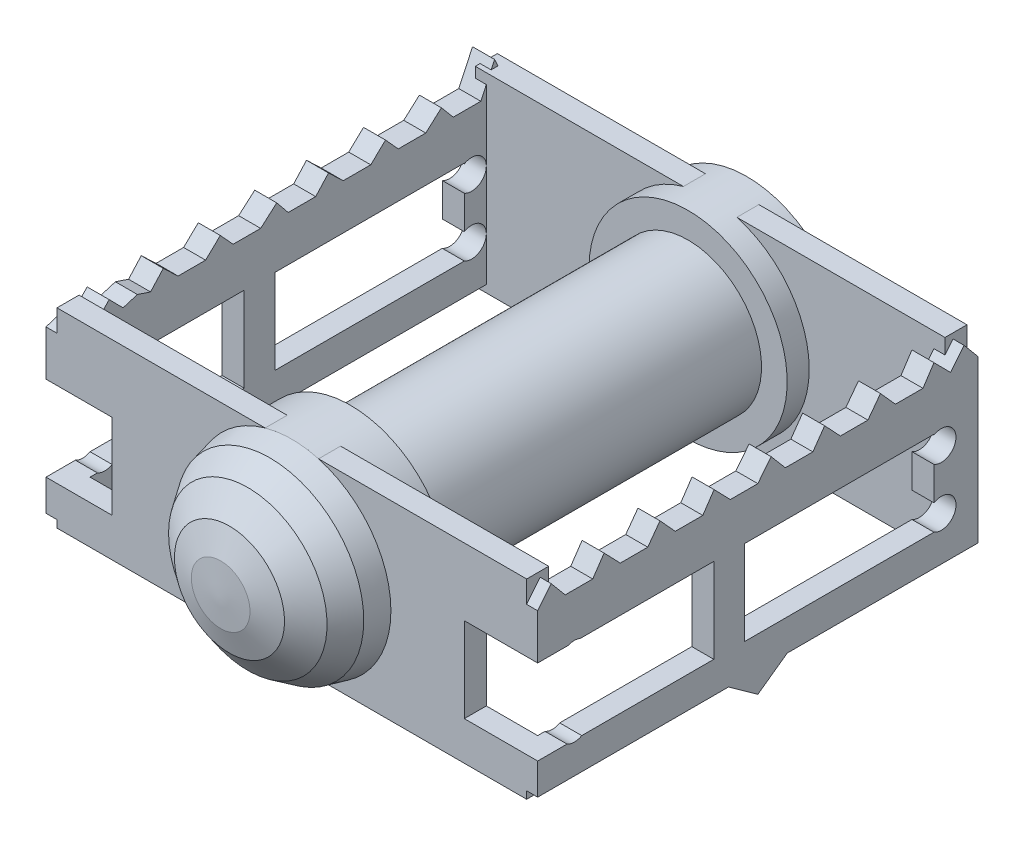
from build123d import *

# Parameters (mm, degrees)
PLACA_DELANTERA_START               = 203
PLACA_DELANTERA_DEPTH               = 3
AGUJERO_PLACA_DELANTERA_1_PROFILE_R = 2
AGUJERO_PLACA_DELANTERA_2_PROFILE_R = 2
AGUJERO_PLACA_DELANTERA_3_PROFILE_R = 2
AGUJERO_PLACA_DELANTERA_4_PROFILE_R = 2
PLACA_TRASERA_START                 = 139
PLACA_TRASERA_DEPTH                 = 3
AGUJERO_PLACA_TRASERA_1_PROFILE_R   = 2
AGUJERO_PLACA_TRASERA_2_PROFILE_R   = 2
AGUJERO_PLACA_TRASERA_3_PROFILE_R   = 2
AGUJERO_PLACA_TRASERA_4_PROFILE_R   = 2
MARCO_INTERIOR_START                = 86
SK_MARCO_INTERIOR_W                 = 64
SK_MARCO_INTERIOR_H                 = 26
SK_MARCO_INTERIOR_R                 = 11
MARCO_INTERIOR_DEPTH                = 3
MARCO_EXTERIOR_START                = 143
SK_MARCO_EXTERIOR_W                 = 64
SK_MARCO_EXTERIOR_H                 = 26
SK_MARCO_EXTERIOR_R                 = 11
MARCO_EXTERIOR_DEPTH                = 3
CROQUIS17_W                         = 25.795648089
CROQUIS17_H                         = 11.561302328
CORTAR_EXTRUIR1_DEPTH               = 10
MATRIZL1_COPY_1_SKETCH_W            = 25.795648089
MATRIZL1_COPY_1_SKETCH_H            = 11.561302328
MATRIZL1_COPY_1_DEPTH               = 10
MATRIZL1_COPY_2_SKETCH_W            = 25.795648089
MATRIZL1_COPY_2_SKETCH_H            = 11.561302328
MATRIZL1_COPY_2_DEPTH               = 10


with BuildPart() as part:
    # Sk_Eje_cuerpo → Eje_cuerpo (revolve)
    with BuildSketch(Plane(origin=(0, 0, 0), x_dir=(1, 0, 0), z_dir=(0, 1, 0))):
        Polygon((183.5, -84), (186, -84), (186, -92), (182.5, -92), (182.5, -138), (186, -138), (186, -146), (185.3, -149), (183.3, -152), (180, -154.5), (176.5, -155.7), (172.5, -156), (172.5, -147), (183.5, -147), (183.5, -138.5), (178.8, -138.5), (178.8, -91.5), (183.5, -91.5), align=None)
    revolve(axis=Axis((172.5, 0, 62.1), (0, 0, 1)))



with BuildPart() as body_2:
    # Sk_Placa_delantera → Placa_delantera (new body)
    with BuildSketch(Plane(origin=(0, 0, 0), x_dir=(0, 0, -1), z_dir=(1, 0, 0)).offset(PLACA_DELANTERA_START)):
        Polygon((-86, -12), (-112, -12), (-116, -14.871140988), (-120, -12), (-146, -12), (-146, 10), (-144.158210385, 12.281479313), (-142.25, 10), (-140.792887545, 10), (-138.5, 10), (-136.9468043, 12.281479313), (-134.75, 10), (-133.341101257, 10), (-131, 10), (-129.334764543, 12.281479313), (-127.25, 10), (-125.809188235, 10), (-123.5, 10), (-121.96310499, 12.281479313), (-119.75, 10), (-117.956768276, 10), (-116, 10), (-114.190811765, 12.281479313), (-112.25, 10), (-110.665235457, 10), (-108.5, 10), (-106.899278945, 12.281479313), (-104.75, 10), (-103.0531957, 10), (-101, 10), (-99.287239189, 12.281479313), (-97.25, 10), (-95.601409412, 10), (-93.5, 10), (-92, 12.281479313), (-89.75, 10), (-87.909242921, 12.281479313), (-86, 10), align=None)
    extrude(amount=PLACA_DELANTERA_DEPTH)

    # Agujero_Placa_delantera_1: sweep along a curve in space
    with BuildLine() as agujero_placa_delantera_1_path:
        Line((201.5, -6, 91), (207.5, -6, 91))
    # Agujero_Placa_delantera_1 profile (on start of the path) → Agujero_Placa_delantera_1 (sweep, cut)
    with BuildSketch(Plane(origin=(201.5, -6, 91), x_dir=(0, 0, 1), z_dir=(1, 0, 0))):
        Circle(AGUJERO_PLACA_DELANTERA_1_PROFILE_R)
    sweep(path=agujero_placa_delantera_1_path.line, mode=Mode.SUBTRACT)

    # Agujero_Placa_delantera_2: sweep along a curve in space
    with BuildLine() as agujero_placa_delantera_2_path:
        Line((201.5, 2, 91), (207.5, 2, 91))
    # Agujero_Placa_delantera_2 profile (on start of the path) → Agujero_Placa_delantera_2 (sweep, cut)
    with BuildSketch(Plane(origin=(201.5, 2, 91), x_dir=(0, 0, 1), z_dir=(1, 0, 0))):
        Circle(AGUJERO_PLACA_DELANTERA_2_PROFILE_R)
    sweep(path=agujero_placa_delantera_2_path.line, mode=Mode.SUBTRACT)

    # Agujero_Placa_delantera_3: sweep along a curve in space
    with BuildLine() as agujero_placa_delantera_3_path:
        Line((201.5, -6, 141), (207.5, -6, 141))
    # Agujero_Placa_delantera_3 profile (on start of the path) → Agujero_Placa_delantera_3 (sweep, cut)
    with BuildSketch(Plane(origin=(201.5, -6, 141), x_dir=(0, 0, 1), z_dir=(1, 0, 0))):
        Circle(AGUJERO_PLACA_DELANTERA_3_PROFILE_R)
    sweep(path=agujero_placa_delantera_3_path.line, mode=Mode.SUBTRACT)

    # Agujero_Placa_delantera_4: sweep along a curve in space
    with BuildLine() as agujero_placa_delantera_4_path:
        Line((201.5, 2, 141), (207.5, 2, 141))
    # Agujero_Placa_delantera_4 profile (on start of the path) → Agujero_Placa_delantera_4 (sweep, cut)
    with BuildSketch(Plane(origin=(201.5, 2, 141), x_dir=(0, 0, 1), z_dir=(1, 0, 0))):
        Circle(AGUJERO_PLACA_DELANTERA_4_PROFILE_R)
    sweep(path=agujero_placa_delantera_4_path.line, mode=Mode.SUBTRACT)


with BuildPart() as body_3:
    # Sk_Placa_trasera → Placa_trasera (new body)
    with BuildSketch(Plane(origin=(0, 0, 0), x_dir=(0, 0, -1), z_dir=(1, 0, 0)).offset(PLACA_TRASERA_START)):
        Polygon((-86, -12), (-146, -12), (-146, 10), (-144.158210385, 10.594712137), (-142.25, 10), (-140.392253874, 11.91414288), (-138.5, 10), (-136.546170629, 10.594712137), (-134.75, 10), (-133.02059432, 11.91414288), (-131, 10), (-129.014257606, 10), (-127.25, 10), (-125.248301095, 11.91414288), (-123.5, 10), (-121.241964381, 10), (-119.75, 10), (-117.556134605, 11.91414288), (-116, 10), (-113.790178093, 10), (-112.25, 10), (-110.504981988, 11.91414288), (-108.5, 10), (-106.498645274, 10), (-104.75, 10), (-102.732688763, 11.91414288), (-101, 10), (-98.646225315, 10), (-97.25, 10), (-95.120649006, 11.91414288), (-93.5, 10), (-91.274565761, 10), (-89.75, 10), (-87.875, 14), (-86, 10), align=None)
    extrude(amount=PLACA_TRASERA_DEPTH)

    # Agujero_Placa_trasera_1: sweep along a curve in space
    with BuildLine() as agujero_placa_trasera_1_path:
        Line((137.5, -6, 91), (143.5, -6, 91))
    # Agujero_Placa_trasera_1 profile (on start of the path) → Agujero_Placa_trasera_1 (sweep, cut)
    with BuildSketch(Plane(origin=(137.5, -6, 91), x_dir=(0, 0, 1), z_dir=(1, 0, 0))):
        Circle(AGUJERO_PLACA_TRASERA_1_PROFILE_R)
    sweep(path=agujero_placa_trasera_1_path.line, mode=Mode.SUBTRACT)

    # Agujero_Placa_trasera_2: sweep along a curve in space
    with BuildLine() as agujero_placa_trasera_2_path:
        Line((137.5, 2, 91), (143.5, 2, 91))
    # Agujero_Placa_trasera_2 profile (on start of the path) → Agujero_Placa_trasera_2 (sweep, cut)
    with BuildSketch(Plane(origin=(137.5, 2, 91), x_dir=(0, 0, 1), z_dir=(1, 0, 0))):
        Circle(AGUJERO_PLACA_TRASERA_2_PROFILE_R)
    sweep(path=agujero_placa_trasera_2_path.line, mode=Mode.SUBTRACT)

    # Agujero_Placa_trasera_3: sweep along a curve in space
    with BuildLine() as agujero_placa_trasera_3_path:
        Line((137.5, -6, 141), (143.5, -6, 141))
    # Agujero_Placa_trasera_3 profile (on start of the path) → Agujero_Placa_trasera_3 (sweep, cut)
    with BuildSketch(Plane(origin=(137.5, -6, 141), x_dir=(0, 0, 1), z_dir=(1, 0, 0))):
        Circle(AGUJERO_PLACA_TRASERA_3_PROFILE_R)
    sweep(path=agujero_placa_trasera_3_path.line, mode=Mode.SUBTRACT)

    # Agujero_Placa_trasera_4: sweep along a curve in space
    with BuildLine() as agujero_placa_trasera_4_path:
        Line((137.5, 2, 141), (143.5, 2, 141))
    # Agujero_Placa_trasera_4 profile (on start of the path) → Agujero_Placa_trasera_4 (sweep, cut)
    with BuildSketch(Plane(origin=(137.5, 2, 141), x_dir=(0, 0, 1), z_dir=(1, 0, 0))):
        Circle(AGUJERO_PLACA_TRASERA_4_PROFILE_R)
    sweep(path=agujero_placa_trasera_4_path.line, mode=Mode.SUBTRACT)


with BuildPart() as part_1:
    add(part.part)

    add(body_2.part)  # Marco_interior merges body 2

    add(body_3.part)  # Marco_interior merges body 3
    # Sk_Marco_interior → Marco_interior (add)
    with BuildSketch(Plane.XY.offset(MARCO_INTERIOR_START)):
        with Locations((172.5, 0)):
            Rectangle(SK_MARCO_INTERIOR_W, SK_MARCO_INTERIOR_H)
        with Locations((172.5, 0)):
            Circle(SK_MARCO_INTERIOR_R, mode=Mode.SUBTRACT)
    extrude(amount=MARCO_INTERIOR_DEPTH)

    # Sk_Marco_exterior → Marco_exterior (add)
    with BuildSketch(Plane.XY.offset(MARCO_EXTERIOR_START)):
        with Locations((172.5, 0)):
            Rectangle(SK_MARCO_EXTERIOR_W, SK_MARCO_EXTERIOR_H)
        with Locations((172.5, 0)):
            Circle(SK_MARCO_EXTERIOR_R, mode=Mode.SUBTRACT)
    extrude(amount=MARCO_EXTERIOR_DEPTH)

    # Croquis17 → Cortar-Extruir1 (cut)
    with BuildSketch(Plane(origin=(206, 0, 0), x_dir=(0, 0, -1), z_dir=(1, 0, 0))):
        with Locations((-104.897824044, -1.951399644)):
            Rectangle(CROQUIS17_W, CROQUIS17_H)
    cortar_extruir1 = extrude(amount=-CORTAR_EXTRUIR1_DEPTH, mode=Mode.SUBTRACT)

    # Simetría1: Cortar-Extruir1 across plane
    add(cortar_extruir1.mirror(Plane(origin=(172, 0, 0), x_dir=(0, 0, 1), z_dir=(1, 0, 0))), mode=Mode.SUBTRACT)

    # MatrizL1 copy 1 sketch → MatrizL1 copy 1 (cut)
    with BuildSketch(Plane(origin=(138, 0, 30), x_dir=(0, 0, -1), z_dir=(-1, 0, 0))):
        with Locations((-104.897824044, 1.951399644)):
            Rectangle(MATRIZL1_COPY_1_SKETCH_W, MATRIZL1_COPY_1_SKETCH_H)
    extrude(amount=-MATRIZL1_COPY_1_DEPTH, mode=Mode.SUBTRACT)

    # MatrizL1 copy 2 sketch → MatrizL1 copy 2 (cut)
    with BuildSketch(Plane(origin=(206, 0, 30), x_dir=(0, 0, -1), z_dir=(1, 0, 0))):
        with Locations((-104.897824044, -1.951399644)):
            Rectangle(MATRIZL1_COPY_2_SKETCH_W, MATRIZL1_COPY_2_SKETCH_H)
    extrude(amount=-MATRIZL1_COPY_2_DEPTH, mode=Mode.SUBTRACT)


solid = part_1.part
